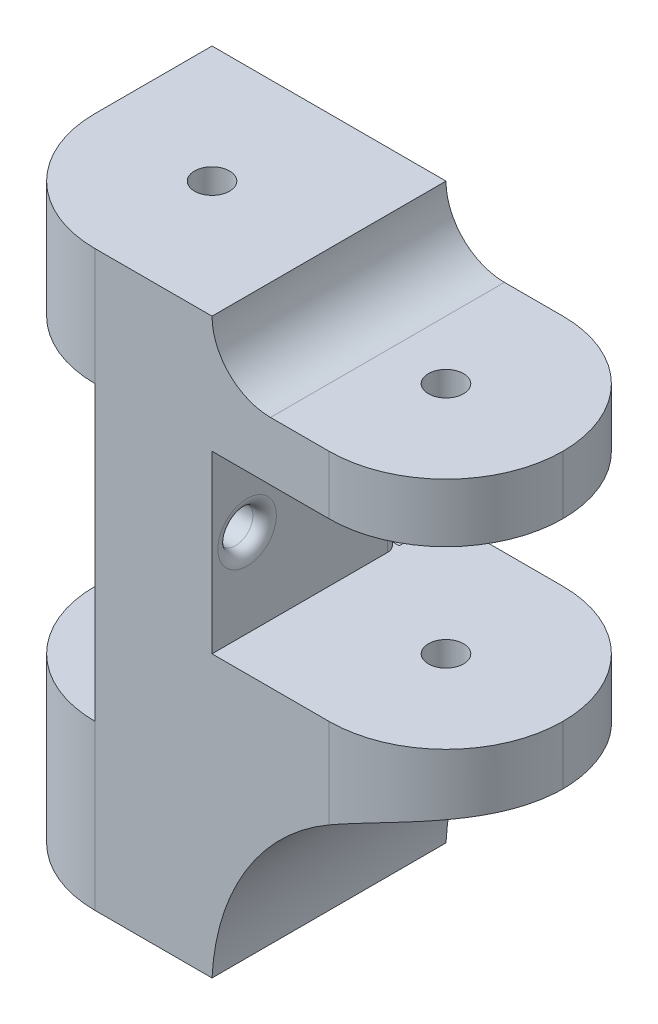
from build123d import *

# Parameters (mm, degrees)
SALIENTE_EXTRUIR1_DEPTH = 20
CROQUIS2_R              = 1.5
CORTAR_EXTRUIR1_DEPTH   = 50
CROQUIS5_W              = 20
CROQUIS5_H              = 15
CORTAR_EXTRUIR3_DEPTH   = 20
CROQUIS7_R              = 1.5
CORTAR_EXTRUIR5_DEPTH   = 30
REDONDEO2_DEPTH         = 49
CROQUIS6_R              = 1.5
CORTAR_EXTRUIR4_DEPTH   = 30
REDONDEO3_R             = 10
CROQUIS8_W              = 7
CROQUIS8_H              = 15
CORTAR_EXTRUIR6_DEPTH   = 10
SKETCH1_W               = 3
SKETCH1_H               = 15
CUT_EXTRUDE1_DEPTH      = 20
FILLET1_R               = 5
CUT_EXTRUDE2_DEPTH      = 4
SKETCH5_W               = 14
SKETCH5_H               = 10
CUT_EXTRUDE3_DEPTH      = 10
FILLET6_R               = 5
CUT_EXTRUDE4_DEPTH      = 16
SKETCH3_R               = 3
BOSS_EXTRUDE1_DEPTH     = 2
SKETCH4_R               = 4
BOSS_EXTRUDE2_DEPTH     = 2
FILLET2_R               = 1
FILLET3_R               = 1
FILLET4_R               = 1
FILLET9_R               = 0.5


with BuildPart() as part:
    # Croquis1 → Saliente-Extruir1 (new body)
    with BuildSketch(Plane.XY):
        with BuildLine():
            ThreePointArc((20, 49), (21.464466094, 45.464466094), (25, 44))
            Line((25, 44), (40, 44))
            Line((40, 44), (40, 19))
            Line((40, 19), (39.974984355, 19))
            ThreePointArc((39.974984355, 19), (26.190935603, 13.491376746), (20, 0))
            Line((20, 0), (0, 0))
            Line((0, 0), (0, 49))
            Line((0, 49), (20, 49))
        make_face()
    extrude(amount=SALIENTE_EXTRUIR1_DEPTH)

    # Croquis2 → Cortar-Extruir1 (cut)
    with BuildSketch(Plane.XZ):
        with Locations(Location((10, 10, 0), (0, 0, 270))):
            Circle(CROQUIS2_R)
    extrude(amount=-CORTAR_EXTRUIR1_DEPTH, mode=Mode.SUBTRACT)

    # Croquis5 → Cortar-Extruir3 (cut)
    with BuildSketch(Plane(origin=(40, 0, 0), x_dir=(0, 0, -1), z_dir=(1, 0, 0))):
        with Locations((-10, 31.5)):
            Rectangle(CROQUIS5_W, CROQUIS5_H)
    extrude(amount=-CORTAR_EXTRUIR3_DEPTH, mode=Mode.SUBTRACT)

    # Croquis7 → Cortar-Extruir5 (cut)
    with BuildSketch(Plane(origin=(20, 0, 0), x_dir=(0, 0, -1), z_dir=(1, 0, 0))):
        with Locations((-17, 31.5)):
            Circle(CROQUIS7_R)
    extrude(amount=-CORTAR_EXTRUIR5_DEPTH, mode=Mode.SUBTRACT)

    # Redondeo2: read off the stored shape, not the designer's step
    # Redondeo2 outline → Redondeo2 (cut)
    with BuildSketch(Plane(origin=(0, 0, 0), x_dir=(1, 0, 0), z_dir=(0, 1, 0))):
        with BuildLine():
            ThreePointArc((10, -20), (2.928932188, -17.071067812), (0, -10))
            Line((0, -10), (0, -20))
            Line((0, -20), (10, -20))
        make_face()
    extrude(amount=REDONDEO2_DEPTH, mode=Mode.SUBTRACT)

    # Croquis6 → Cortar-Extruir4 (cut)
    with BuildSketch(Plane(origin=(0, 44, 0), x_dir=(1, 0, 0), z_dir=(0, 1, 0))):
        with Locations(Location((30, -10, 0), (0, 0, 180))):
            Circle(CROQUIS6_R)
    extrude(amount=-CORTAR_EXTRUIR4_DEPTH, mode=Mode.SUBTRACT)

    # Redondeo3
    redondeo3_edges = [part.edges().sort_by_distance(p)[0] for p in [
        (40, 21.5, 0),
        (40, 41.5, 0),
        (40, 21.5, 20),
        (40, 41.5, 20),
    ]]
    fillet(redondeo3_edges, radius=REDONDEO3_R - 0.0001)  # a hair under: the kernel refuses the full size

    # Croquis8 → Cortar-Extruir6 (cut)
    with BuildSketch(Plane.ZY):
        with Locations((16.5, 31.5)):
            Rectangle(CROQUIS8_W, CROQUIS8_H)
    extrude(amount=-CORTAR_EXTRUIR6_DEPTH, mode=Mode.SUBTRACT)

    # Sketch1 → Cut-Extrude1 (cut)
    with BuildSketch(Plane(origin=(0, 0, 0), x_dir=(-1, 0, 0), z_dir=(0, 0, -1))):
        with Locations((-1.5, 31.5)):
            Rectangle(SKETCH1_W, SKETCH1_H)
    extrude(amount=-CUT_EXTRUDE1_DEPTH, mode=Mode.SUBTRACT)

    # Fillet1
    fillet1_edges = [part.edges().sort_by_distance(p)[0] for p in [
        (3, 31.5, 13),
    ]]
    fillet(fillet1_edges, radius=FILLET1_R)

    # Sketch2 → Cut-Extrude2 (cut)
    with BuildSketch(Plane(origin=(0, 0, 0), x_dir=(-1, 0, 0), z_dir=(0, 0, -1))):
        with BuildLine():
            Line((-20, 34.5), (-14, 34.5))
            ThreePointArc((-14, 34.5), (-8, 28.5), (-14, 22.5))
            Line((-14, 22.5), (-20, 22.5))
            Line((-20, 22.5), (-20, 34.5))
        make_face()
        with BuildLine():
            Line((-6, 16), (0, 16))
            Line((0, 16), (0, 4))
            Line((0, 4), (-6, 4))
            ThreePointArc((-6, 4), (-12, 10), (-6, 16))
        make_face()
    extrude(amount=-CUT_EXTRUDE2_DEPTH, mode=Mode.SUBTRACT)

    # Sketch5 → Cut-Extrude3 (cut)
    with BuildSketch(Plane.ZY):
        with Locations((13, 19)):
            Rectangle(SKETCH5_W, SKETCH5_H)
    extrude(amount=-CUT_EXTRUDE3_DEPTH, mode=Mode.SUBTRACT)

    # Fillet6
    # the kernel refuses this fillet: 5 mm, written as the material it takes off along each edge
    with BuildSketch(Plane(origin=(0, 14, 6), x_dir=(1, 0, 0), z_dir=(0, 1, 0))) as fillet6_piece_1:
        with BuildLine():
            CenterArc((FILLET6_R, FILLET6_R), FILLET6_R, 180, 90)
            Line((0, FILLET6_R), (0, 0))
            Line((0, 0), (FILLET6_R, 0))
        make_face()
    extrude(amount=10, mode=Mode.SUBTRACT)

    # Sketch6 → Cut-Extrude4 (cut)
    with BuildSketch(Plane.ZY.offset(-10)):
        with BuildLine():
            Line((12, 16), (12, 22))
            ThreePointArc((12, 22), (13, 23), (14, 22))
            Line((14, 22), (14, 16))
            ThreePointArc((14, 16), (13, 15), (12, 16))
        make_face()
    extrude(amount=-CUT_EXTRUDE4_DEPTH, mode=Mode.SUBTRACT)

    # Sketch3 → Boss-Extrude1 (add)
    with BuildSketch(Plane(origin=(0, 0, 4), x_dir=(-1, 0, 0), z_dir=(0, 0, -1))):
        with Locations((-14, 28.5)):
            Circle(SKETCH3_R)
        with Locations((-6, 10)):
            Circle(SKETCH3_R)
    extrude(amount=BOSS_EXTRUDE1_DEPTH)

    # Sketch4 → Boss-Extrude2 (add)
    with BuildSketch(Plane(origin=(0, 0, 2), x_dir=(-1, 0, 0), z_dir=(0, 0, -1))):
        with Locations((-14, 28.5)):
            Circle(SKETCH4_R)
        with Locations((-6, 10)):
            Circle(SKETCH4_R)
    extrude(amount=BOSS_EXTRUDE2_DEPTH)

    # Fillet2
    fillet2_edges = [part.edges().sort_by_distance(p)[0] for p in [
        (17, 28.5, 4),
        (17, 28.5, 2),
        (9, 10, 4),
        (9, 10, 2),
    ]]
    fillet(fillet2_edges, radius=FILLET2_R - 0.0001)  # a hair under: the kernel refuses the full size

    # Fillet3
    fillet3_edges = [part.edges().sort_by_distance(p)[0] for p in [
        (20, 29.25, 4),
        (0, 9, 4),
    ]]
    fillet(fillet3_edges, radius=FILLET3_R)

    # Fillet4
    fillet4_edges = [part.edges().sort_by_distance(p)[0] for p in [
        (10, 31.5, 18.5),
        (20, 31.5, 18.5),
    ]]
    fillet(fillet4_edges, radius=FILLET4_R)

    # Fillet9
    fillet9_edges = [part.edges().sort_by_distance(p)[0] for p in [
        (10, 15, 13),
        (10, 19, 14),
        (10, 23, 13),
        (10, 19, 12),
    ]]
    fillet(fillet9_edges, radius=FILLET9_R - 0.0001)  # a hair under: the kernel refuses the full size


solid = part.part
